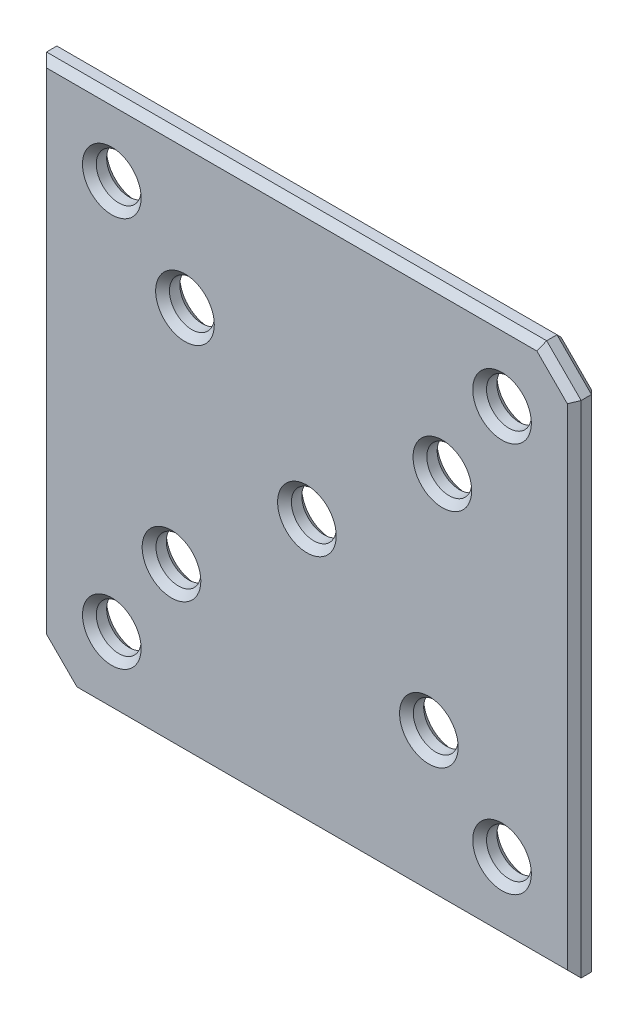
from build123d import *

# Parameters (mm, degrees)
SKETCH_1_R         = 13
EXTRUDE_1140_DEPTH = 14
CHAMFER_1_SIZE     = 4


with BuildPart() as part:
    # 草图1 → Extrude 1140 (new body)
    with BuildSketch(Plane.XY):
        Polygon((135, 155), (155, 135), (155, -155), (-135, -155), (-155, -135), (-155, 155), align=None)
        with Locations((-113.13708499, -113.13708499)):
            Circle(SKETCH_1_R, mode=Mode.SUBTRACT)
        with Locations((-78.524110604, -61.919012055)):
            Circle(SKETCH_1_R, mode=Mode.SUBTRACT)
        with Locations((78.524110604, 61.919012055)):
            Circle(SKETCH_1_R, mode=Mode.SUBTRACT)
        with Locations((113.13708499, 113.13708499)):
            Circle(SKETCH_1_R, mode=Mode.SUBTRACT)
        with Locations((-70.710678119, 70.710678119)):
            Circle(SKETCH_1_R, mode=Mode.SUBTRACT)
        with Locations((-113.13708499, 113.13708499)):
            Circle(SKETCH_1_R, mode=Mode.SUBTRACT)
        with Locations((70.710678119, -70.710678119)):
            Circle(SKETCH_1_R, mode=Mode.SUBTRACT)
        with Locations((113.13708499, -113.13708499)):
            Circle(SKETCH_1_R, mode=Mode.SUBTRACT)
        Circle(SKETCH_1_R, mode=Mode.SUBTRACT)
    extrude(amount=EXTRUDE_1140_DEPTH)

    # 倒角1
    chamfer_1_edges = [part.edges().sort_by_distance(p)[0] for p in [
        (100.13708499, -113.13708499, 0),
        (57.710678119, -70.710678119, 0),
        (-83.710678119, 70.710678119, 0),
        (65.524110604, 61.919012055, 0),
        (-126.13708499, -113.13708499, 0),
        (-145, -145, 0),
        (10, -155, 0),
        (155, -10, 0),
        (145, 145, 0),
        (-10, 155, 0),
        (-155, 10, 0),
        (-91.524110604, -61.919012055, 0),
        (100.13708499, 113.13708499, 0),
        (-126.13708499, 113.13708499, 0),
        (-13, 0, 0),
        (100.13708499, -113.13708499, 14),
        (57.710678119, -70.710678119, 14),
        (-83.710678119, 70.710678119, 14),
        (65.524110604, 61.919012055, 14),
        (-126.13708499, -113.13708499, 14),
        (-10, 155, 14),
        (145, 145, 14),
        (155, -10, 14),
        (10, -155, 14),
        (-145, -145, 14),
        (-155, 10, 14),
        (-91.524110604, -61.919012055, 14),
        (100.13708499, 113.13708499, 14),
        (-126.13708499, 113.13708499, 14),
        (-13, 0, 14),
    ]]
    chamfer(chamfer_1_edges, length=CHAMFER_1_SIZE)


solid = part.part
